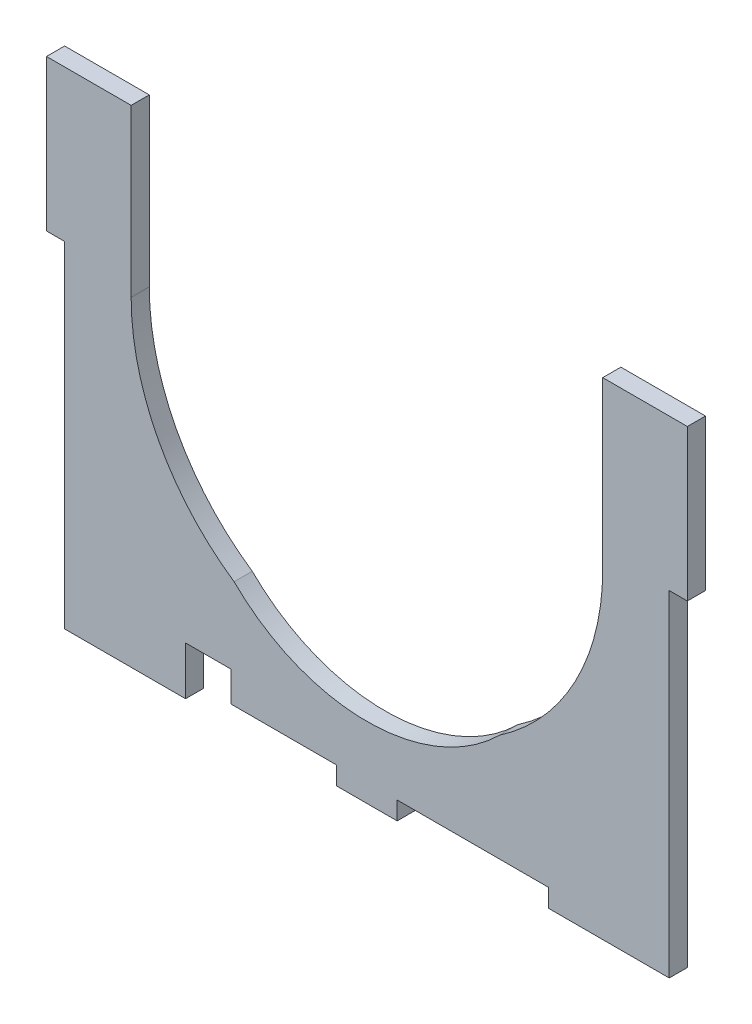
from build123d import *

# Parameters (mm, degrees)
BOSS_EXTRUDE1_DEPTH = 6
SKETCH3_W           = 6
SKETCH3_H           = 50
BOSS_EXTRUDE2_DEPTH = 6
LPATTERN1_COUNT     = 2
LPATTERN1_PITCH     = 206
SKETCH4_W           = 40
SKETCH4_H           = 6
SKETCH4_W_2         = 20
BOSS_EXTRUDE3_DEPTH = 6
SKETCH5_W           = 15
SKETCH5_H           = 10
CUT_EXTRUDE1_DEPTH  = 10


with BuildPart() as part:
    # Sketch1 → Boss-Extrude1 (new body)
    with BuildSketch(Plane.XY):
        with BuildLine():
            Line((-178, 100), (-178, 155))
            Line((-178, 155), (-200, 155))
            Line((-200, 155), (-200, 0))
            Line((-200, 0), (0, 0))
            Line((0, 0), (0, 155))
            Line((0, 155), (-22, 155))
            Line((-22, 155), (-22, 100))
            ThreePointArc((-22, 100), (-31.037807258, 63.555302549), (-56.056819802, 35.55625))
            ThreePointArc((-56.056819802, 35.55625), (-100, 17.5), (-143.943180198, 35.55625))
            ThreePointArc((-143.943180198, 35.55625), (-168.962192742, 63.555302549), (-178, 100))
        make_face()
    extrude(amount=BOSS_EXTRUDE1_DEPTH)

    # Sketch3 → Boss-Extrude2 (add)
    with BuildSketch(Plane.XY.offset(6)):
        with Locations((-203, 130)):
            Rectangle(SKETCH3_W, SKETCH3_H)
    boss_extrude2 = extrude(amount=-BOSS_EXTRUDE2_DEPTH)

    # LPattern1: Boss-Extrude2 ×2
    with Locations(*[(i * LPATTERN1_PITCH, 0, 0) for i in range(1, LPATTERN1_COUNT)]):
        add(boss_extrude2)

    # Sketch4 → Boss-Extrude3 (add)
    with BuildSketch(Plane.XY.offset(6)):
        with Locations((-180, -3)):
            Rectangle(SKETCH4_W, SKETCH4_H)
        with Locations((-100, -3)):
            Rectangle(SKETCH4_W_2, SKETCH4_H)
        with Locations((-20, -3)):
            Rectangle(SKETCH4_W, SKETCH4_H)
    extrude(amount=-BOSS_EXTRUDE3_DEPTH)

    # Sketch5 → Cut-Extrude1 (cut)
    with BuildSketch(Plane.XY.offset(6)):
        with Locations((-152.5, 5)):
            Rectangle(SKETCH5_W, SKETCH5_H)
    extrude(amount=-CUT_EXTRUDE1_DEPTH, mode=Mode.SUBTRACT)


solid = part.part
